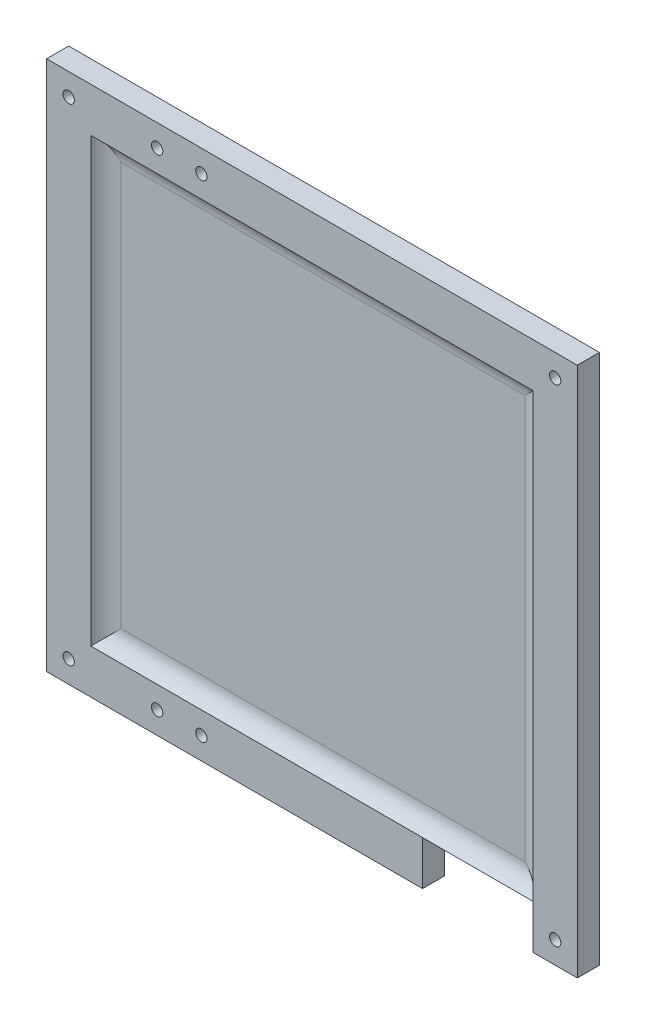
from build123d import *

# Parameters (mm, degrees)
SKETCH1_W           = 240
SKETCH1_H           = 240
SKETCH1_R           = 2.55
BOSS_EXTRUDE1_DEPTH = 10
SKETCH2_W           = 200
SKETCH2_H           = 200
CUT_EXTRUDE1_DEPTH  = 5
FILLET1_R           = 10
SKETCH3_W           = 50
SKETCH3_H           = 20
CUT_EXTRUDE2_DEPTH  = 150


with BuildPart() as part:
    # Sketch1 → Boss-Extrude1 (new body)
    with BuildSketch(Plane.XY):
        Rectangle(SKETCH1_W, SKETCH1_H)
        with Locations((-110, 110)):
            Circle(SKETCH1_R, mode=Mode.SUBTRACT)
        with Locations(Location((110, 110, 0), (0, 0, 180))):
            Circle(SKETCH1_R, mode=Mode.SUBTRACT)
        with Locations((110, -110)):
            Circle(SKETCH1_R, mode=Mode.SUBTRACT)
        with Locations(Location((-110, -110, 0), (0, 0, 180))):
            Circle(SKETCH1_R, mode=Mode.SUBTRACT)
        with Locations((-70, 110)):
            Circle(SKETCH1_R, mode=Mode.SUBTRACT)
        with Locations(Location((-70, -110, 0), (0, 0, 180))):
            Circle(SKETCH1_R, mode=Mode.SUBTRACT)
        with Locations((-50, 110)):
            Circle(SKETCH1_R, mode=Mode.SUBTRACT)
        with Locations(Location((-50, -110, 0), (0, 0, 180))):
            Circle(SKETCH1_R, mode=Mode.SUBTRACT)
    extrude(amount=BOSS_EXTRUDE1_DEPTH)

    # Sketch2 → Cut-Extrude1 (cut)
    with BuildSketch(Plane.XY.offset(10)):
        Rectangle(SKETCH2_W, SKETCH2_H)
    extrude(amount=-CUT_EXTRUDE1_DEPTH, mode=Mode.SUBTRACT)

    # Fillet1
    # the kernel refuses this fillet: 10 mm, written as the material it adds along each edge
    with BuildSketch(Plane(origin=(100, -100, 5), x_dir=(0, 0, 1), z_dir=(0, 1, 0)), Plane(origin=(-100, -100, 5), x_dir=(0, 0, 1), z_dir=(1, 0, 0)), Plane(origin=(-100, 100, 5), x_dir=(0, 0, 1), z_dir=(0, -1, 0)), Plane(origin=(100, 100, 5), x_dir=(0, 0, 1), z_dir=(-1, 0, 0))) as fillet1_piece_1:
        with BuildLine():
            CenterArc((10, -8.660254038), FILLET1_R, 120, 60)
            Line((0, -8.660254038), (0, 0))
            Line((0, 0), (5, 0))
        make_face()
    extrude(amount=200)

    # Sketch3 → Cut-Extrude2 (cut)
    with BuildSketch(Plane.XY.offset(10)):
        with Locations((75, -110)):
            Rectangle(SKETCH3_W, SKETCH3_H)
    extrude(amount=-CUT_EXTRUDE2_DEPTH, mode=Mode.SUBTRACT)


solid = part.part
